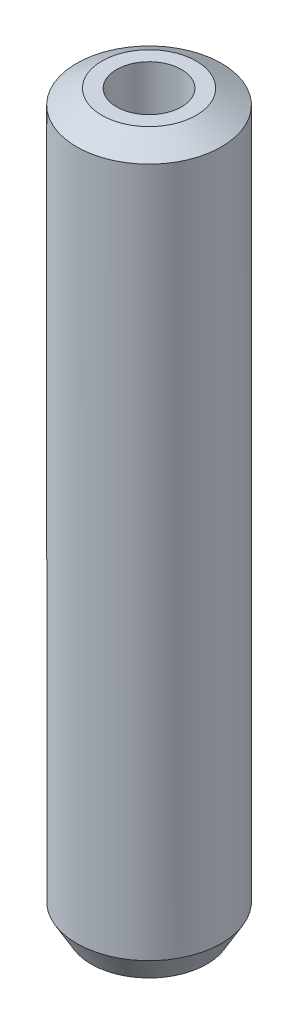
from build123d import *
from OCP.BRepFilletAPI import BRepFilletAPI_MakeChamfer

# Parameters (mm, degrees)
SKETCH1_R           = 20
BOSS_EXTRUDE1_DEPTH = 201.548727917
SKETCH2_R           = 8.962545089
CUT_EXTRUDE1_DEPTH  = 204.52368345
CHAMFER1_SIZE       = 4.03346849
CHAMFER1_SIZE2      = 6.986172356


with BuildPart() as part:
    # Sketch1 → Boss-Extrude1 (new body)
    with BuildSketch(Plane(origin=(0, 0, 0), x_dir=(1, 0, 0), z_dir=(0, 1, 0))):
        Circle(SKETCH1_R)
    extrude(amount=BOSS_EXTRUDE1_DEPTH)

    # Sketch2 → Cut-Extrude1 (cut, through all)
    with BuildSketch(Plane(origin=(0, 0, 0), x_dir=(1, 0, 0), z_dir=(0, 1, 0))):
        Circle(SKETCH2_R)
    extrude(amount=CUT_EXTRUDE1_DEPTH, mode=Mode.SUBTRACT)

    # Chamfer1: one chamfer whose edges measure the first distance from different faces: ONE call of the kernel's chamfer builder (chamfer() names one face for all edges)
    chamfer1_edges_1 = [part.edges().sort_by_distance(p)[0] for p in [
        (-20, 201.548727917, 0),
    ]]
    chamfer1_side_1 = [part.faces().sort_by_distance(p)[0] for p in [
        (-20, 100.774363959, 0),
    ]]
    chamfer1_edges_2 = [part.edges().sort_by_distance(p)[0] for p in [
        (-20, 0, 0),
    ]]
    chamfer1_side_2 = [part.faces().sort_by_distance(p)[0] for p in [
        (-19.434314575, 0, 0),
    ]]
    chamfer1 = BRepFilletAPI_MakeChamfer(part.part.solid().wrapped)
    for e in chamfer1_edges_1:
        chamfer1.Add(CHAMFER1_SIZE, CHAMFER1_SIZE2, e.wrapped, chamfer1_side_1[0].wrapped)  # the first distance lies on this face
    for e in chamfer1_edges_2:
        chamfer1.Add(CHAMFER1_SIZE, CHAMFER1_SIZE2, e.wrapped, chamfer1_side_2[0].wrapped)  # the first distance lies on this face
    add(Compound.cast(chamfer1.Shape()), mode=Mode.REPLACE)


solid = part.part
